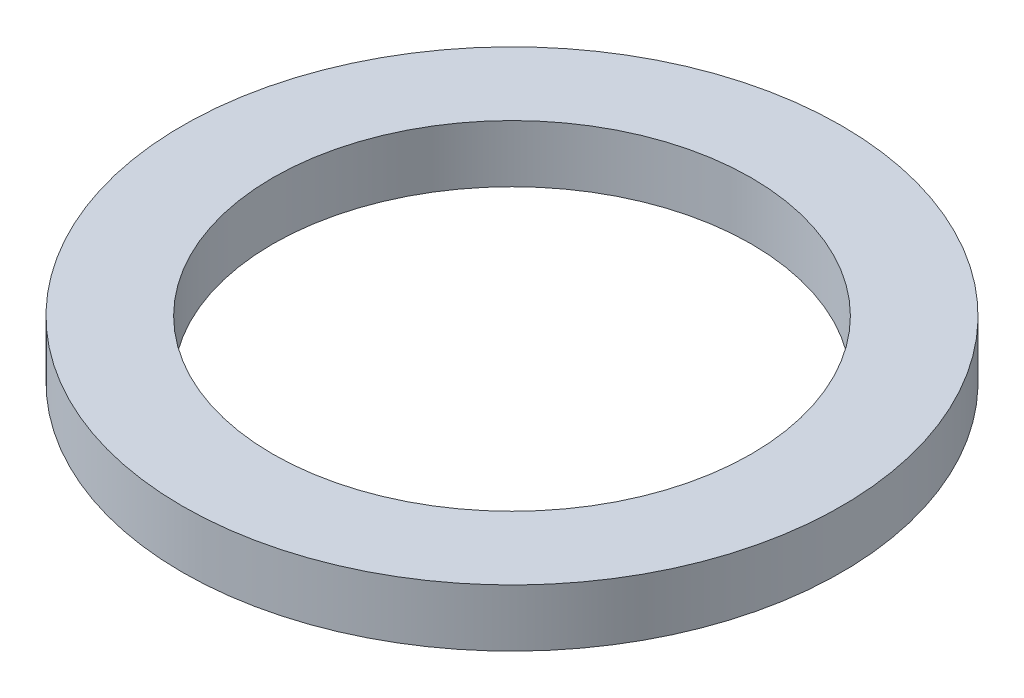
from build123d import *

# Parameters (mm, degrees)
SKETCH_1_R      = 23
SKETCH_1_R_2    = 16.7
EXTRUDE_1_DEPTH = 4


with BuildPart() as part:
    # Эскиз1 → Бобышка-Вытянуть1 (new body)
    with BuildSketch(Plane(origin=(0, 0, 0), x_dir=(1, 0, 0), z_dir=(0, 1, 0))):
        Circle(SKETCH_1_R)
        Circle(SKETCH_1_R_2, mode=Mode.SUBTRACT)
    extrude(amount=EXTRUDE_1_DEPTH)


solid = part.part
